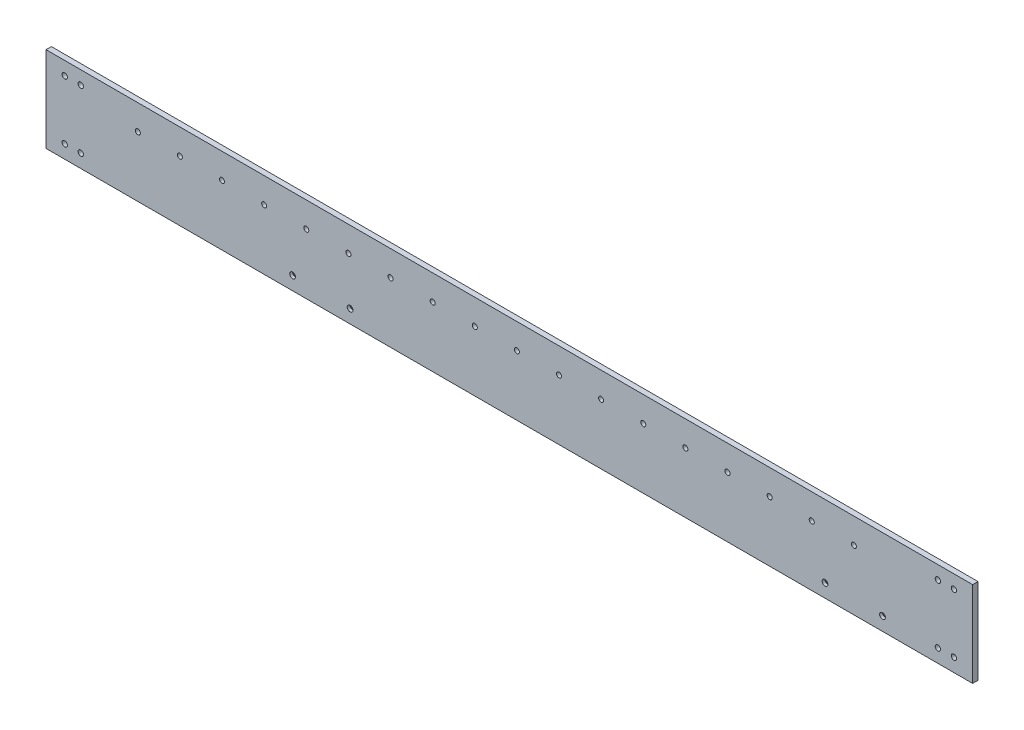
from build123d import *

# Parameters (mm, degrees)
SKETCH1_W                                       = 3.175
SKETCH1_H                                       = 50.8
BOSS_EXTRUDE1_DEPTH                             = 550
SIDEHOLES_SKETCH4_R                             = 1.5875
SIDEHOLES_SKETCH4_R_2                           = 1.5
SIDEHOLES_CUT_EXTRUDE3_DEPTH                    = 553.350179347
CSK_FOR_M3_FLAT_HEAD_MACHINE_SCREW1_D           = 3.4
CSK_FOR_M3_FLAT_HEAD_MACHINE_SCREW1_CSINK_D     = 6.3
CSK_FOR_M3_FLAT_HEAD_MACHINE_SCREW1_CSINK_ANGLE = 90


with BuildPart() as part:
    # Sketch1 → Boss-Extrude1 (new body)
    with BuildSketch(Plane(origin=(0, 0, 0), x_dir=(0, 0, -1), z_dir=(1, 0, 0))):
        with Locations((-1.5875, 25.4)):
            Rectangle(SKETCH1_W, SKETCH1_H)
    extrude(amount=BOSS_EXTRUDE1_DEPTH)

    # SideHoles-Sketch4 → SideHoles-Cut-Extrude3 (cut, through all)
    with BuildSketch(Plane.XY.offset(3.175)):
        with Locations((11.1125, 42.8625)):
            Circle(SIDEHOLES_SKETCH4_R)
        with Locations((529.3625, 42.8625)):
            Circle(SIDEHOLES_SKETCH4_R)
        with Locations((20.6375, 42.8625)):
            Circle(SIDEHOLES_SKETCH4_R)
        with Locations((538.8875, 42.8625)):
            Circle(SIDEHOLES_SKETCH4_R)
        with Locations((11.1125, 7.9375)):
            Circle(SIDEHOLES_SKETCH4_R)
        with Locations((20.6375, 7.9375)):
            Circle(SIDEHOLES_SKETCH4_R)
        with Locations((529.3625, 7.9375)):
            Circle(SIDEHOLES_SKETCH4_R)
        with Locations((538.8875, 7.9375)):
            Circle(SIDEHOLES_SKETCH4_R)
        with Locations((54.5, 35.8)):
            Circle(SIDEHOLES_SKETCH4_R_2)
        with Locations((79.5, 35.8)):
            Circle(SIDEHOLES_SKETCH4_R_2)
        with Locations((104.5, 35.8)):
            Circle(SIDEHOLES_SKETCH4_R_2)
        with Locations((129.5, 35.8)):
            Circle(SIDEHOLES_SKETCH4_R_2)
        with Locations((154.5, 35.8)):
            Circle(SIDEHOLES_SKETCH4_R_2)
        with Locations((179.5, 35.8)):
            Circle(SIDEHOLES_SKETCH4_R_2)
        with Locations((204.5, 35.8)):
            Circle(SIDEHOLES_SKETCH4_R_2)
        with Locations((229.5, 35.8)):
            Circle(SIDEHOLES_SKETCH4_R_2)
        with Locations((254.5, 35.8)):
            Circle(SIDEHOLES_SKETCH4_R_2)
        with Locations((279.5, 35.8)):
            Circle(SIDEHOLES_SKETCH4_R_2)
        with Locations((304.5, 35.8)):
            Circle(SIDEHOLES_SKETCH4_R_2)
        with Locations((329.5, 35.8)):
            Circle(SIDEHOLES_SKETCH4_R_2)
        with Locations((354.5, 35.8)):
            Circle(SIDEHOLES_SKETCH4_R_2)
        with Locations((379.5, 35.8)):
            Circle(SIDEHOLES_SKETCH4_R_2)
        with Locations((496.4875, 7.9375)):
            Circle(SIDEHOLES_SKETCH4_R)
        with Locations((180.4875, 7.9375)):
            Circle(SIDEHOLES_SKETCH4_R)
        with Locations((404.5, 35.8)):
            Circle(SIDEHOLES_SKETCH4_R_2)
        with Locations((429.5, 35.8)):
            Circle(SIDEHOLES_SKETCH4_R_2)
        with Locations((454.5, 35.8)):
            Circle(SIDEHOLES_SKETCH4_R_2)
        with Locations((479.5, 35.8)):
            Circle(SIDEHOLES_SKETCH4_R_2)
        with Locations((146.3625, 7.9375)):
            Circle(SIDEHOLES_SKETCH4_R)
        with Locations((462.3625, 7.9375)):
            Circle(SIDEHOLES_SKETCH4_R)
    extrude(amount=-SIDEHOLES_CUT_EXTRUDE3_DEPTH, mode=Mode.SUBTRACT)

    # CSK for M3 Flat Head Machine Screw1 (through all)
    with Locations(Plane(origin=(0, 0, 0), x_dir=(-1, 0, 0), z_dir=(0, 0, -1))):
        with Locations((-496.4875, 7.9375), (-462.3625, 7.9375), (-180.4875, 7.9375), (-146.3625, 7.9375)):
            CounterSinkHole(CSK_FOR_M3_FLAT_HEAD_MACHINE_SCREW1_D / 2, CSK_FOR_M3_FLAT_HEAD_MACHINE_SCREW1_CSINK_D / 2, counter_sink_angle=CSK_FOR_M3_FLAT_HEAD_MACHINE_SCREW1_CSINK_ANGLE)


solid = part.part
